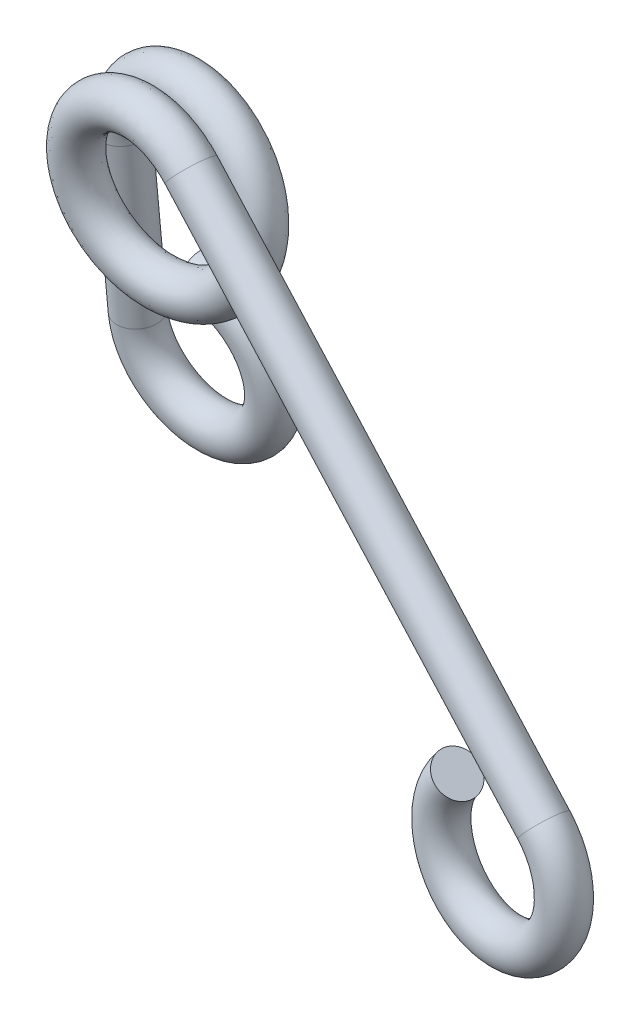
from build123d import *

# Parameters (mm, degrees)
SWEEP1_PITCH        = 1.691093574
SWEEP1_HEIGHT       = 2.304
SWEEP1_RADIUS       = 2.925
SWEEP1_START_ANGLE  = -180
SWEEP1_PROFILE_R    = 0.7685
SKETCH7_R           = 0.7685
BOSS_EXTRUDE1_DEPTH = 6.112
SKETCH8_R           = 0.7685
BOSS_EXTRUDE2_DEPTH = 19.442
SKETCH11_R          = 0.7685
SKETCH13_R          = 0.7685


with BuildPart() as part:
    # Sweep1: sweep along a helix
    with BuildLine() as sweep1_path:
        add(Helix(SWEEP1_PITCH, SWEEP1_HEIGHT, SWEEP1_RADIUS, center=(0, 0, 0), direction=(0, 0, 1), lefthand=True, mode=Mode.PRIVATE).rotate(Axis((0, 0, 0), (0, 0, 1)), SWEEP1_START_ANGLE))
    # Sweep1 profile (on start of the path) → Sweep1 (sweep)
    with BuildSketch(Plane(origin=(-2.925, 0, 0), x_dir=(0, -0.09162860589234262, 0.9957932509222112), z_dir=(-7.6569073854344e-14, 0.9957932509222112, 0.09162860589234262))):
        Circle(SWEEP1_PROFILE_R)
    sweep(path=sweep1_path.line, is_frenet=True)

    # Sketch7 → Boss-Extrude1 (add)
    with BuildSketch(Plane(origin=(0, 0, 0), x_dir=(1, 0, 0), z_dir=(6.564467280906747e-15, -0.9957932509222046, -0.09162860589241552))):
        with Locations(Location((-2.925, 0, 0), (0, 0, 90))):
            Circle(SKETCH7_R)
    extrude(amount=BOSS_EXTRUDE1_DEPTH)


with BuildPart() as boss_extrude2_tool:
    # Sketch8 → Boss-Extrude2 (new body)
    with BuildSketch(Plane(origin=(0.159938056, -0.136479, 0.019346658), x_dir=(0.09594107198175887, -0.028611187354864856, -0.9949757337066748), z_dir=(0.7574900772078451, -0.646384546159533, 0.09162860589241528))):
        with Locations(Location((-2.174248504, 3.015560064, 0), (0, 0, 177.678165763))):
            Circle(SKETCH8_R)
    extrude(amount=BOSS_EXTRUDE2_DEPTH)


with BuildPart() as part_1:
    add(part.part)


with BuildPart() as part_2:
    # Boss-Extrude2: joined with boss_extrude2_tool
    add(part_1.part.fuse(boss_extrude2_tool.part, tol=0.00001))

    # Sweep2: sweep along a path in Sketch10
    with BuildLine(Plane(origin=(0, 0, 0), x_dir=(1, 0, 0), z_dir=(0, -0.09162860589241552, 0.9957932509222045))) as sweep2_path:
        ThreePointArc((-2.925, -6.112), (1.342766953, -7.879766953), (-0.425, -3.612))
    # Sketch11 → Sweep2 (sweep)
    with BuildSketch(Plane(origin=(0, -6.08628835, -0.560034039), x_dir=(1, 0, 0), z_dir=(6.564467280906748e-15, -0.9957932509222046, -0.09162860589241552))):
        with Locations((-2.925, 0)):
            Circle(SKETCH11_R)
    sweep(path=sweep2_path.line)

    # Sweep3: sweep along a path in Sketch12
    with BuildLine(Plane(origin=(-0.208599732, 0.062207831, 2.1633245), x_dir=(-0.9953867575774242, -0.002038063344902809, -0.09592209931660459), z_dir=(0.09594107198175894, -0.02861118735486476, -0.9949757337066749))) as sweep3_path:
        ThreePointArc((-16.919923176, -10.442978366), (-15.499640038, -14.838616041), (-13.395746669, -10.726138995))
    # Sketch13 → Sweep3 (sweep)
    with BuildSketch(Plane(origin=(14.887060137, -12.703487346, 1.800790013), x_dir=(0.09594107198175886, -0.028611187354864908, -0.9949757337066749), z_dir=(0.7574900772078451, -0.646384546159533, 0.0916286058924153))):
        with Locations((-2.174248504, 3.015560064)):
            Circle(SKETCH13_R)
    sweep(path=sweep3_path.line)


solid = part_2.part
